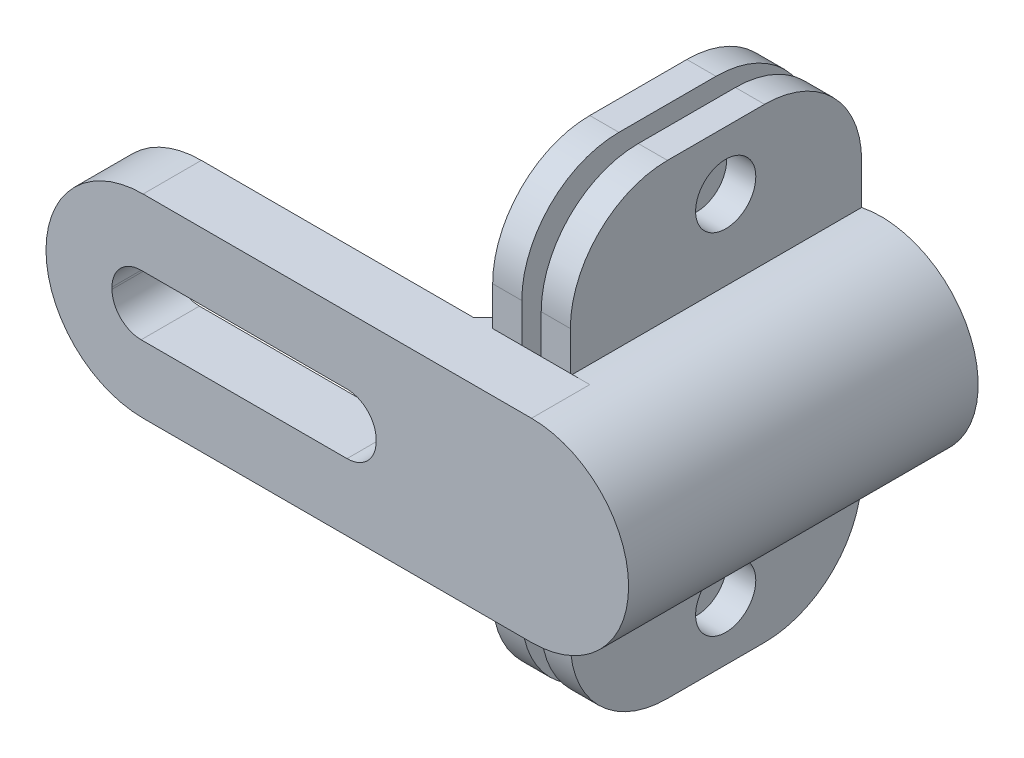
from build123d import *

# Parameters (mm, degrees)
SZKIC1_W                    = 30
SZKIC1_H                    = 10
DODANIE_WYCI_GNI_CIE1_DEPTH = 3
ZAOKR_GLENIE1_R             = 5
WYTNIJ_WYCI_GNI_CIE1_REACH  = 33.765
SZKIC2_W                    = 13.6
SZKIC2_H                    = 3.1
ZAOKR_GLENIE2_R             = 1.5
SZKIC3_R                    = 5
DODANIE_WYCI_GNI_CIE2_DEPTH = 15
SZKIC5_W                    = 1.5
SZKIC5_H                    = 24
DODANIE_WYCI_GNI_CIE3_DEPTH = 15
SZKIC4_R                    = 4.05
WYTNIJ_WYCI_GNI_CIE2_DEPTH  = 15
SZKIC6_W                    = 1
SZKIC6_H                    = 10.631374676
WYTNIJ_WYCI_GNI_CIE3_DEPTH  = 15
SZKIC7_R                    = 1.55
WYTNIJ_WYCI_GNI_CIE4_DEPTH  = 34.015148038
ZAOKR_GLENIE3_R             = 5
SFAZOWANIE1_SIZE            = 1


with BuildPart() as part:
    # Szkic1 → Dodanie-wyciągnięcie1 (new body)
    with BuildSketch(Plane.XY):
        with Locations((15, 5)):
            Rectangle(SZKIC1_W, SZKIC1_H)
    extrude(amount=DODANIE_WYCI_GNI_CIE1_DEPTH)

    # Zaokrąglenie1
    zaokr_glenie1_edges = [part.edges().sort_by_distance(p)[0] for p in [
        (0, 10, 1.5),
        (0, 0, 1.5),
        (30, 10, 1.5),
        (30, 0, 1.5),
    ]]
    fillet(zaokr_glenie1_edges, radius=ZAOKR_GLENIE1_R - 0.0001)  # a hair under: the kernel refuses the full size

    # Szkic2 → Wytnij-wyciągnięcie1 (cut, up to next)
    with BuildSketch(Plane.XY.offset(3), mode=Mode.PRIVATE) as wytnij_wyci_gni_cie1_sk1:
        with Locations((10.2, 5)):
            Rectangle(SZKIC2_W, SZKIC2_H)
    wytnij_wyci_gni_cie1_tool1 = extrude(wytnij_wyci_gni_cie1_sk1.sketch, amount=-WYTNIJ_WYCI_GNI_CIE1_REACH, mode=Mode.PRIVATE) & part.part
    add(wytnij_wyci_gni_cie1_tool1.solids().sort_by_distance((10.2, 5, 3))[0], mode=Mode.SUBTRACT)

    # Zaokrąglenie2
    zaokr_glenie2_edges = [part.edges().sort_by_distance(p)[0] for p in [
        (3.4, 3.45, 1.5),
        (3.4, 6.55, 1.5),
        (17, 6.55, 1.5),
        (17, 3.45, 1.5),
    ]]
    fillet(zaokr_glenie2_edges, radius=ZAOKR_GLENIE2_R)

    # Szkic3 → Dodanie-wyciągnięcie2 (add)
    with BuildSketch(Plane(origin=(0, 0, 0), x_dir=(-1, 0, 0), z_dir=(0, 0, -1))):
        with Locations((-25, 5)):
            Circle(SZKIC3_R)
    extrude(amount=DODANIE_WYCI_GNI_CIE2_DEPTH)

    # Szkic5 → Dodanie-wyciągnięcie3 (add)
    with BuildSketch(Plane(origin=(0, 0, -15), x_dir=(-1, 0, 0), z_dir=(0, 0, -1))):
        with Locations((-20.75, 5)):
            Rectangle(SZKIC5_W, SZKIC5_H)
        with Locations((-23.25, 5)):
            Rectangle(SZKIC5_W, SZKIC5_H)
    extrude(amount=-DODANIE_WYCI_GNI_CIE3_DEPTH)

    # Szkic4 → Wytnij-wyciągnięcie2 (cut)
    with BuildSketch(Plane(origin=(0, 0, -15), x_dir=(-1, 0, 0), z_dir=(0, 0, -1))):
        with Locations((-25, 5)):
            Circle(SZKIC4_R)
    extrude(amount=-WYTNIJ_WYCI_GNI_CIE2_DEPTH, mode=Mode.SUBTRACT)

    # Szkic6 → Wytnij-wyciągnięcie3 (cut)
    with BuildSketch(Plane(origin=(0, 0, -15), x_dir=(-1, 0, 0), z_dir=(0, 0, -1))):
        with Locations((-22, 4.629389041)):
            Rectangle(SZKIC6_W, SZKIC6_H)
    extrude(amount=-WYTNIJ_WYCI_GNI_CIE3_DEPTH, mode=Mode.SUBTRACT)

    # Szkic7 → Wytnij-wyciągnięcie4 (cut, through all)
    with BuildSketch(Plane(origin=(24, 0, 0), x_dir=(0, 0, -1), z_dir=(1, 0, 0))):
        with Locations((8, -4)):
            Circle(SZKIC7_R)
        with Locations((8, 14)):
            Circle(SZKIC7_R)
    extrude(amount=-WYTNIJ_WYCI_GNI_CIE4_DEPTH, mode=Mode.SUBTRACT)

    # Zaokrąglenie3
    zaokr_glenie3_edges = [part.edges().sort_by_distance(p)[0] for p in [
        (23.25, -7, -15),
        (23.25, -7, 0),
        (23.25, 17, 0),
        (23.25, 17, -15),
        (20.75, -7, -15),
        (20.75, -7, 0),
        (20.75, 17, 0),
        (20.75, 17, -15),
    ]]
    fillet(zaokr_glenie3_edges, radius=ZAOKR_GLENIE3_R)

    # Sfazowanie1
    sfazowanie1_edges = [part.edges().sort_by_distance(p)[0] for p in [
        (20, 5, 0),
    ]]
    chamfer(sfazowanie1_edges, length=SFAZOWANIE1_SIZE)


solid = part.part
